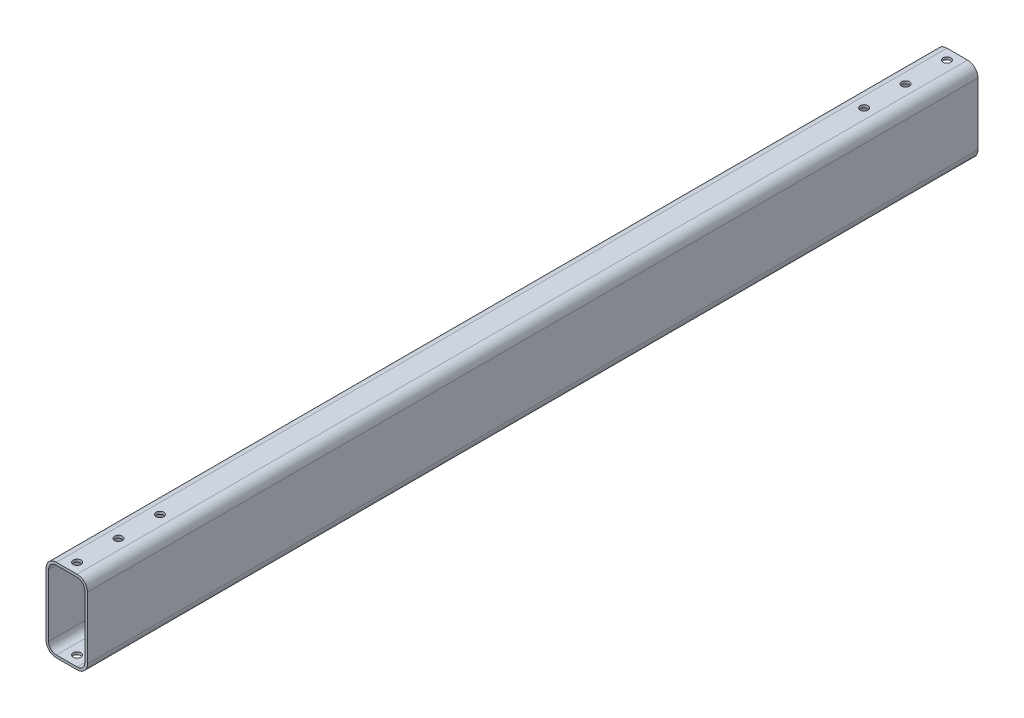
from build123d import *

# Parameters (mm, degrees)
EXTRUDE_THIN1_DEPTH            = 546.1
F_3_16_0_1875_DIAMETER_HOLE1_D = 4.7625


with BuildPart() as part:
    # Sketch1 → Extrude-Thin1 (new body)
    with BuildSketch(Plane.XY):
        with BuildLine():
            Line((-12.7, 19.05), (-12.7, -19.05))
            ThreePointArc((-12.7, -19.05), (-10.840128061, -23.540128061), (-6.35, -25.4))
            Line((-6.35, -25.4), (6.35, -25.4))
            ThreePointArc((6.35, -25.4), (10.840128061, -23.540128061), (12.7, -19.05))
            Line((12.7, -19.05), (12.7, 19.05))
            ThreePointArc((12.7, 19.05), (10.840128061, 23.540128061), (6.35, 25.4))
            Line((6.35, 25.4), (-6.35, 25.4))
            ThreePointArc((-6.35, 25.4), (-10.840128061, 23.540128061), (-12.7, 19.05))
        make_face()
        with BuildLine():
            Line((-11.1125, 19.05), (-11.1125, -19.05))
            ThreePointArc((-11.1125, -19.05), (-9.717596045, -22.417596045), (-6.35, -23.8125))
            Line((-6.35, -23.8125), (6.35, -23.8125))
            ThreePointArc((6.35, -23.8125), (9.717596045, -22.417596045), (11.1125, -19.05))
            Line((11.1125, -19.05), (11.1125, 19.05))
            ThreePointArc((11.1125, 19.05), (9.717596045, 22.417596045), (6.35, 23.8125))
            Line((6.35, 23.8125), (-6.35, 23.8125))
            ThreePointArc((-6.35, 23.8125), (-9.717596045, 22.417596045), (-11.1125, 19.05))
        make_face(mode=Mode.SUBTRACT)
    extrude(amount=EXTRUDE_THIN1_DEPTH)

    # 3/16 (0.1875) Diameter Hole1 (through all)
    with Locations(Plane(origin=(0, 25.4, 539.75), x_dir=(0, 0, 1), z_dir=(0, 1, 0))):
        with Locations((0, 0), (-533.4, 0), (-508, 0), (-482.6, 0), (-25.4, 0), (-50.8, 0)):
            Hole(F_3_16_0_1875_DIAMETER_HOLE1_D / 2)


solid = part.part
